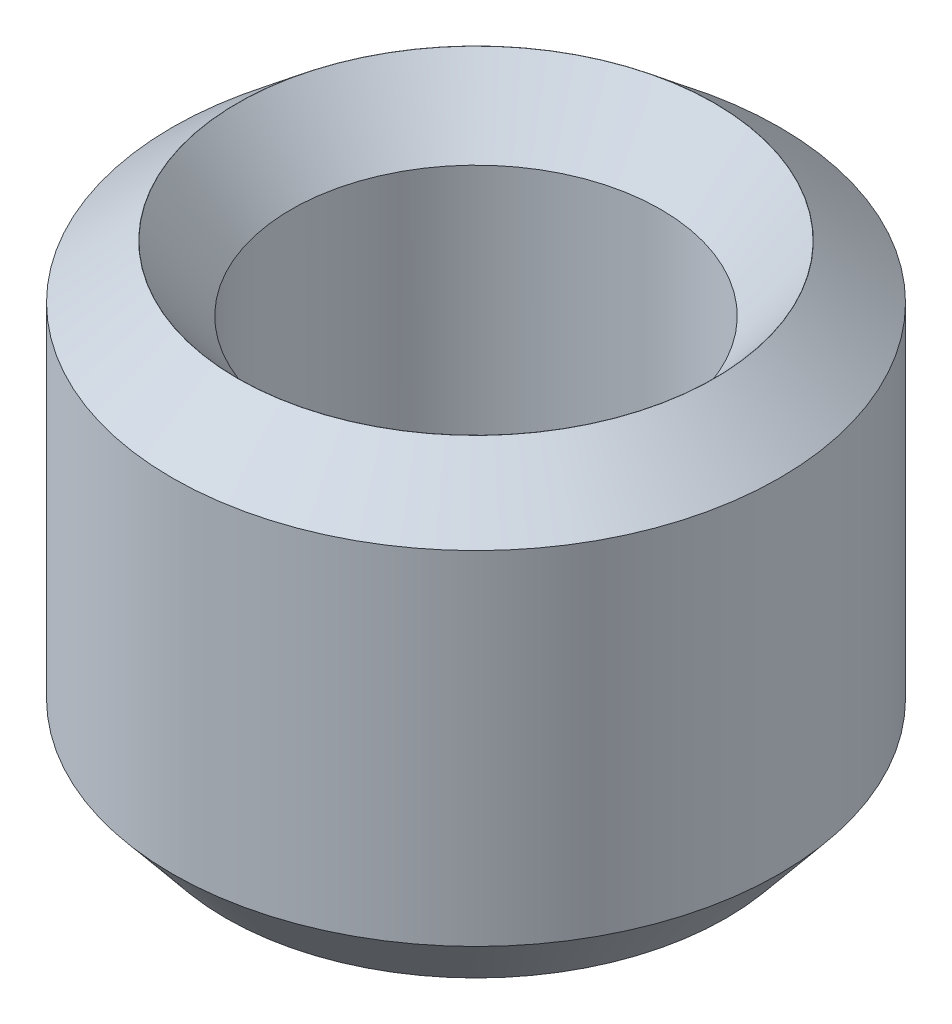
from build123d import *
from OCP.BRepFilletAPI import BRepFilletAPI_MakeChamfer

# Parameters (mm, degrees)
SKETCH1_R           = 10
BOSS_EXTRUDE1_DEPTH = 15.200827126
SKETCH2_R           = 6.082918633
CUT_EXTRUDE1_DEPTH  = 21.762108402
CHAMFER1_SIZE       = 1.765803298
CHAMFER1_SIZE2      = 2.146716894


with BuildPart() as part:
    # Sketch1 → Boss-Extrude1 (new body)
    with BuildSketch(Plane(origin=(0, 0, 0), x_dir=(1, 0, 0), z_dir=(0, 1, 0))):
        Circle(SKETCH1_R)
    extrude(amount=BOSS_EXTRUDE1_DEPTH)

    # Sketch2 → Cut-Extrude1 (cut, through all)
    with BuildSketch(Plane(origin=(0, 0, 0), x_dir=(1, 0, 0), z_dir=(0, 1, 0))):
        Circle(SKETCH2_R)
    extrude(amount=CUT_EXTRUDE1_DEPTH, mode=Mode.SUBTRACT)

    # Chamfer1: one chamfer whose edges measure the first distance from different faces: ONE call of the kernel's chamfer builder (chamfer() names one face for all edges)
    chamfer1_edges_1 = [part.edges().sort_by_distance(p)[0] for p in [
        (-6.082918633, 15.200827126, 0),
    ]]
    chamfer1_side_1 = [part.faces().sort_by_distance(p)[0] for p in [
        (-9.717157288, 15.200827126, 0),
    ]]
    chamfer1_edges_2 = [part.edges().sort_by_distance(p)[0] for p in [
        (-6.082918633, 0, 0),
    ]]
    chamfer1_side_2 = [part.faces().sort_by_distance(p)[0] for p in [
        (-6.082918633, 7.600413563, 0),
    ]]
    chamfer1_edges_3 = [part.edges().sort_by_distance(p)[0] for p in [
        (-10, 0, 0),
    ]]
    chamfer1_side_3 = [part.faces().sort_by_distance(p)[0] for p in [
        (-9.717157288, 0, 0),
    ]]
    chamfer1_edges_4 = [part.edges().sort_by_distance(p)[0] for p in [
        (-10, 15.200827126, 0),
    ]]
    chamfer1_side_4 = [part.faces().sort_by_distance(p)[0] for p in [
        (-10, 7.600413563, 0),
    ]]
    chamfer1 = BRepFilletAPI_MakeChamfer(part.part.solid().wrapped)
    for e in chamfer1_edges_1:
        chamfer1.Add(CHAMFER1_SIZE, CHAMFER1_SIZE2, e.wrapped, chamfer1_side_1[0].wrapped)  # the first distance lies on this face
    for e in chamfer1_edges_2:
        chamfer1.Add(CHAMFER1_SIZE, CHAMFER1_SIZE2, e.wrapped, chamfer1_side_2[0].wrapped)  # the first distance lies on this face
    for e in chamfer1_edges_3:
        chamfer1.Add(CHAMFER1_SIZE, CHAMFER1_SIZE2, e.wrapped, chamfer1_side_3[0].wrapped)  # the first distance lies on this face
    for e in chamfer1_edges_4:
        chamfer1.Add(CHAMFER1_SIZE, CHAMFER1_SIZE2, e.wrapped, chamfer1_side_4[0].wrapped)  # the first distance lies on this face
    add(Compound.cast(chamfer1.Shape()), mode=Mode.REPLACE)


solid = part.part
